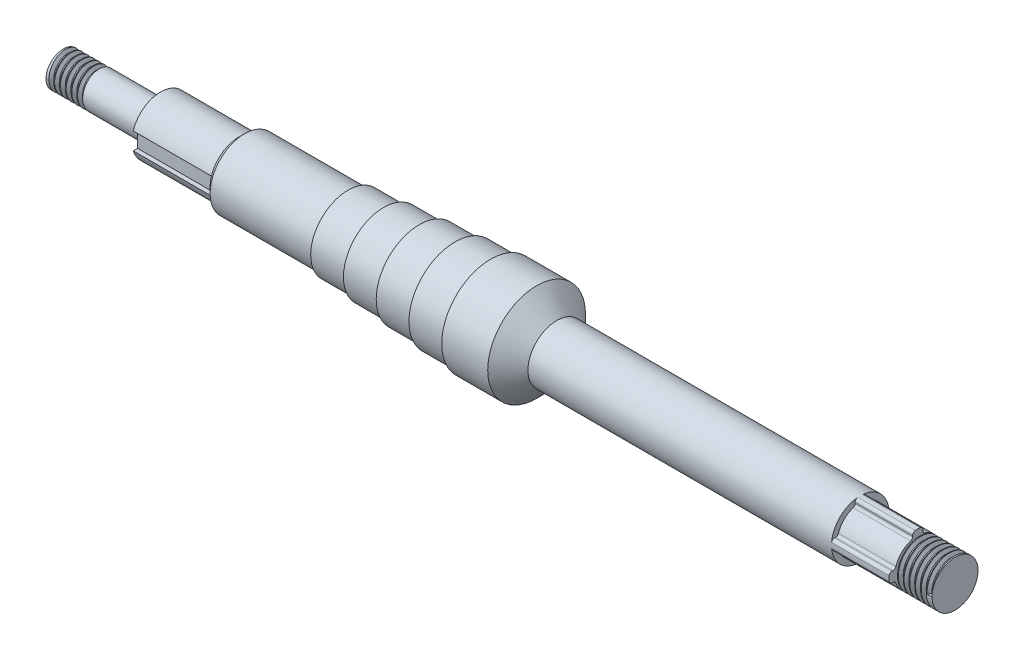
from build123d import *

# Parameters (mm, degrees)
THREAD1_PITCH      = 1
THREAD1_TO         = 6.5
THREAD2_PITCH      = 1
CUT_EXTRUDE2_START = -10
CUT_EXTRUDE2_DEPTH = 10
FILLET1_START      = 138.66
FILLET1_DEPTH      = 11.34
FILLET1_START_2    = 138
FILLET1_2_DEPTH    = 10.66
CUT_EXTRUDE6_START = -13.61
CUT_EXTRUDE6_DEPTH = 153.351732826
CIRPATTERN1_COUNT  = 2


with BuildPart() as part:
    # Sketch1 → Revolve1 (revolve)
    with BuildSketch(Plane.XY, mode=Mode.PRIVATE) as revolve1_sk:
        Polygon((0, 0), (0, 3), (6.5, 3), (16.94, 3), (16.94, 5), (20.87, 5), (30.55, 5), (31.55, 6), (49.55, 6), (49.55, 6.5), (55.75, 6.5), (55.75, 7), (61.95, 7), (61.95, 7.5), (68.15, 7.5), (68.15, 8), (74.35, 8), (74.35, 8.5), (82.35, 8.5), (85.85, 5), (111.66, 5), (148.66, 5), (148.66, 4), (155.16, 4), (155.16, 0), align=None)
    revolve(revolve1_sk.sketch.rotate(Axis((0, 0, 0), (1, 0, 0)), 90), axis=Axis((0, 0, 0), (1, 0, 0)))

    # Thread1: arcs per turn and ends read off the stored shape
    # Thread1: the profile of Thread Profile1 profile screwed along a right-hand helix through 6.5 turns, 8 arcs to a turn; built about Z, then put on its axis
    thread1_z = Axis((0, 0, 0), (0, 0, 1))
    thread1_corners = [(4.0003, 0, -0.000173205), (4.0003, 0, 0.875173202), (3.458734125, 0, 0.562499999), (3.458734125, 0, 0.312499999)]
    with BuildLine(mode=Mode.PRIVATE) as thread1_profile:
        Line(thread1_corners[0], thread1_corners[1])
        Line(thread1_corners[1], thread1_corners[2])
        Line(thread1_corners[2], thread1_corners[3])
        Line(thread1_corners[3], thread1_corners[0])
    thread1_cap = Face(thread1_profile.wire())
    thread1_turn_angles = [0, 22.5, 45, 67.5, 90, 112.5, 135, 157.5, 180, 202.5, 225, 247.5, 270, 292.5, 315, 337.5, 360]
    thread1_turn_weights = [1, 0.9238795325112867, 1, 0.9238795325112867, 1, 0.9238795325112867, 1, 0.9238795325112867, 1, 0.9238795325112867, 1, 0.9238795325112867, 1, 0.9238795325112867, 1, 0.9238795325112867, 1]
    thread1_turn_rails = [Edge.make_bspline([Vector(p[0], p[1], 0).rotate(thread1_z, thread1_turn_angles[k]) / thread1_turn_weights[k] + Vector(0, 0, p[2] + THREAD1_PITCH * thread1_turn_angles[k] / 360) for k in range(17)], [0, 0, 0, 1, 1, 2, 2, 3, 3, 4, 4, 5, 5, 6, 6, 7, 7, 8, 8, 8], 2, thread1_turn_weights) for p in thread1_corners]
    thread1_turn_sides = [Face.make_surface_from_curves(thread1_turn_rails[p[0]], thread1_turn_rails[p[1]]) for p in [(0, 1), (1, 2), (2, 3), (3, 0)]]
    thread1_last_angles = [2160, 2182.5, 2205, 2227.5, 2250, 2272.5, 2295, 2317.5, 2340]
    thread1_last_weights = [1, 0.9238795325112867, 1, 0.9238795325112867, 1, 0.9238795325112867, 1, 0.9238795325112806, 1]
    thread1_last_rails = [Edge.make_bspline([Vector(p[0], p[1], 0).rotate(thread1_z, thread1_last_angles[k]) / thread1_last_weights[k] + Vector(0, 0, p[2] + THREAD1_PITCH * thread1_last_angles[k] / 360) for k in range(9)], [0, 0, 0, 1, 1, 2, 2, 3, 3, 4, 4, 4], 2, thread1_last_weights) for p in thread1_corners]
    thread1_last_sides = [Face.make_surface_from_curves(thread1_last_rails[p[0]], thread1_last_rails[p[1]]) for p in [(0, 1), (1, 2), (2, 3), (3, 0)]]
    thread1 = Plane(origin=(155.16, 0, 0), x_dir=(0, 0, 1), z_dir=(-1, 0, 0)) * split(Solid(Shell([*[p.moved(Location((0, 0, THREAD1_PITCH * i))) for i in range(6) for p in thread1_turn_sides], *thread1_last_sides, thread1_cap, thread1_cap.rotate(thread1_z, 2340).moved(Location((0, 0, THREAD1_PITCH * 2340 / 360)))])), bisect_by=Plane.XY.offset(THREAD1_TO), keep=Keep.BOTTOM, mode=Mode.PRIVATE)
    add(thread1, mode=Mode.SUBTRACT)

    # Thread2: arcs per turn and ends read off the stored shape
    # Thread2: the profile of Thread Profile2 profile screwed along a right-hand helix through 6 turns, 8 arcs to a turn; built about Z, then put on its axis
    thread2_z = Axis((0, 0, 0), (0, 0, 1))
    thread2_corners = [(3.0003, 0, -0.000173205), (3.0003, 0, 0.875173202), (2.458734125, 0, 0.562499999), (2.458734125, 0, 0.312499999)]
    with BuildLine(mode=Mode.PRIVATE) as thread2_profile:
        Line(thread2_corners[0], thread2_corners[1])
        Line(thread2_corners[1], thread2_corners[2])
        Line(thread2_corners[2], thread2_corners[3])
        Line(thread2_corners[3], thread2_corners[0])
    thread2_cap = Face(thread2_profile.wire())
    thread2_turn_angles = [0, 22.5, 45, 67.5, 90, 112.5, 135, 157.5, 180, 202.5, 225, 247.5, 270, 292.5, 315, 337.5, 360]
    thread2_turn_weights = [1, 0.9238795325112867, 1, 0.9238795325112867, 1, 0.9238795325112867, 1, 0.9238795325112867, 1, 0.9238795325112867, 1, 0.9238795325112867, 1, 0.9238795325112867, 1, 0.9238795325112867, 1]
    thread2_turn_rails = [Edge.make_bspline([Vector(p[0], p[1], 0).rotate(thread2_z, thread2_turn_angles[k]) / thread2_turn_weights[k] + Vector(0, 0, p[2] + THREAD2_PITCH * thread2_turn_angles[k] / 360) for k in range(17)], [0, 0, 0, 1, 1, 2, 2, 3, 3, 4, 4, 5, 5, 6, 6, 7, 7, 8, 8, 8], 2, thread2_turn_weights) for p in thread2_corners]
    thread2_turn_sides = [Face.make_surface_from_curves(thread2_turn_rails[p[0]], thread2_turn_rails[p[1]]) for p in [(0, 1), (1, 2), (2, 3), (3, 0)]]
    thread2 = Plane(origin=(0, 0, 0), x_dir=(0, 0, -1), z_dir=(1, 0, 0)) * Solid(Shell([*[p.moved(Location((0, 0, THREAD2_PITCH * i))) for i in range(6) for p in thread2_turn_sides], thread2_cap, thread2_cap.rotate(thread2_z, 2160).moved(Location((0, 0, THREAD2_PITCH * 2160 / 360)))]))
    add(thread2, mode=Mode.SUBTRACT)

    # Cut-Extrude2: read off the stored shape, not the designer's step
    # Cut-Extrude2 outline → Cut-Extrude2 (cut)
    with BuildSketch(Plane(origin=(148.66, 0, 0), x_dir=(0, 0, -1), z_dir=(1, 0, 0)).offset(CUT_EXTRUDE2_START)):
        with BuildLine():
            ThreePointArc((0.881040396, 3.901764706), (2.828427125, 2.828427125), (3.901764706, 0.881040396))
            Line((3.901764706, 0.881040396), (4.921764706, 0.881040396))
            ThreePointArc((4.921764706, 0.881040396), (3.535533906, 3.535533906), (0.881040396, 4.921764706))
            Line((0.881040396, 4.921764706), (0.881040396, 3.901764706))
        make_face()
        with BuildLine():
            Line((4.921764706, -0.881040396), (3.901764706, -0.881040396))
            ThreePointArc((3.901764706, -0.881040396), (2.828427125, -2.828427125), (0.881040396, -3.901764706))
            Line((0.881040396, -3.901764706), (0.881040396, -4.921764706))
            ThreePointArc((0.881040396, -4.921764706), (3.535533906, -3.535533906), (4.921764706, -0.881040396))
        make_face()
        with BuildLine():
            ThreePointArc((-3.901764706, 0.881040396), (-2.828427125, 2.828427125), (-0.881040396, 3.901764706))
            Line((-0.881040396, 3.901764706), (-0.881040396, 4.921764706))
            ThreePointArc((-0.881040396, 4.921764706), (-3.535533906, 3.535533906), (-4.921764706, 0.881040396))
            Line((-4.921764706, 0.881040396), (-3.901764706, 0.881040396))
        make_face()
        with BuildLine():
            Line((-0.881040396, -4.921764706), (-0.881040396, -3.901764706))
            ThreePointArc((-0.881040396, -3.901764706), (-2.828427125, -2.828427125), (-3.901764706, -0.881040396))
            Line((-3.901764706, -0.881040396), (-4.921764706, -0.881040396))
            ThreePointArc((-4.921764706, -0.881040396), (-3.535533906, -3.535533906), (-0.881040396, -4.921764706))
        make_face()
    extrude(amount=CUT_EXTRUDE2_DEPTH, mode=Mode.SUBTRACT)

    # Fillet1: read off the stored shape, not the designer's step
    # Fillet1 outline → Fillet1 (cut)
    with BuildSketch(Plane.YZ.offset(FILLET1_START)):
        with BuildLine():
            Line((-0.881040396, 4.921764706), (-0.881040396, 4.483838558))
            ThreePointArc((-0.881040396, 4.483838558), (-0.749258342, 4.822092227), (-0.423378218, 4.982042842))
            ThreePointArc((-0.423378218, 4.982042842), (-0.65290531, 4.95718818), (-0.881040396, 4.921764706))
        make_face()
        with BuildLine():
            ThreePointArc((-4.982042842, 0.423378218), (-4.822092227, 0.749258342), (-4.483838558, 0.881040396))
            Line((-4.483838558, 0.881040396), (-4.921764706, 0.881040396))
            ThreePointArc((-4.921764706, 0.881040396), (-4.95718818, 0.65290531), (-4.982042842, 0.423378218))
        make_face()
        with BuildLine():
            ThreePointArc((0.881040396, 4.921764706), (0.65290531, 4.95718818), (0.423378218, 4.982042842))
            ThreePointArc((0.423378218, 4.982042842), (0.749258342, 4.822092227), (0.881040396, 4.483838558))
            Line((0.881040396, 4.483838558), (0.881040396, 4.921764706))
        make_face()
        with BuildLine():
            ThreePointArc((-4.483838558, -0.881040396), (-4.822092227, -0.749258342), (-4.982042842, -0.423378218))
            ThreePointArc((-4.982042842, -0.423378218), (-4.95718818, -0.65290531), (-4.921764706, -0.881040396))
            Line((-4.921764706, -0.881040396), (-4.483838558, -0.881040396))
        make_face()
        with BuildLine():
            ThreePointArc((4.982042842, 0.423378218), (4.95718818, 0.65290531), (4.921764706, 0.881040396))
            Line((4.921764706, 0.881040396), (4.483838558, 0.881040396))
            ThreePointArc((4.483838558, 0.881040396), (4.822092227, 0.749258342), (4.982042842, 0.423378218))
        make_face()
        with BuildLine():
            Line((-0.881040396, -4.483838558), (-0.881040396, -4.921764706))
            ThreePointArc((-0.881040396, -4.921764706), (-0.65290531, -4.95718818), (-0.423378218, -4.982042842))
            ThreePointArc((-0.423378218, -4.982042842), (-0.749258342, -4.822092227), (-0.881040396, -4.483838558))
        make_face()
        with BuildLine():
            ThreePointArc((4.921764706, -0.881040396), (4.95718818, -0.65290531), (4.982042842, -0.423378218))
            ThreePointArc((4.982042842, -0.423378218), (4.822092227, -0.749258342), (4.483838558, -0.881040396))
            Line((4.483838558, -0.881040396), (4.921764706, -0.881040396))
        make_face()
        with BuildLine():
            ThreePointArc((0.881040396, -4.483838558), (0.749258342, -4.822092227), (0.423378218, -4.982042842))
            ThreePointArc((0.423378218, -4.982042842), (0.65290531, -4.95718818), (0.881040396, -4.921764706))
            Line((0.881040396, -4.921764706), (0.881040396, -4.483838558))
        make_face()
    extrude(amount=FILLET1_DEPTH, mode=Mode.SUBTRACT)

    # Fillet1 2 outline → Fillet1 2 (add)
    with BuildSketch(Plane.YZ.offset(FILLET1_START_2)):
        with BuildLine():
            ThreePointArc((-0.881040396, 4.282841046), (-0.976859455, 3.988498105), (-1.227591463, 3.806969819))
            ThreePointArc((-1.227591463, 3.806969819), (-1.055380783, 3.858260152), (-0.881040396, 3.901764706))
            Line((-0.881040396, 3.901764706), (-0.881040396, 4.282841046))
        make_face()
        with BuildLine():
            ThreePointArc((-3.901764706, 0.881040396), (-3.858260152, 1.055380783), (-3.806969819, 1.227591463))
            ThreePointArc((-3.806969819, 1.227591463), (-3.988498105, 0.976859455), (-4.282841046, 0.881040396))
            Line((-4.282841046, 0.881040396), (-3.901764706, 0.881040396))
        make_face()
        with BuildLine():
            Line((0.881040396, 4.282841046), (0.881040396, 3.901764706))
            ThreePointArc((0.881040396, 3.901764706), (1.055380783, 3.858260152), (1.227591463, 3.806969819))
            ThreePointArc((1.227591463, 3.806969819), (0.976859455, 3.988498105), (0.881040396, 4.282841046))
        make_face()
        with BuildLine():
            ThreePointArc((-3.806969819, -1.227591463), (-3.858260152, -1.055380783), (-3.901764706, -0.881040396))
            Line((-3.901764706, -0.881040396), (-4.282841046, -0.881040396))
            ThreePointArc((-4.282841046, -0.881040396), (-3.988498105, -0.976859455), (-3.806969819, -1.227591463))
        make_face()
        with BuildLine():
            ThreePointArc((4.282841046, 0.881040396), (3.988498105, 0.976859455), (3.806969819, 1.227591463))
            ThreePointArc((3.806969819, 1.227591463), (3.858260152, 1.055380783), (3.901764706, 0.881040396))
            Line((3.901764706, 0.881040396), (4.282841046, 0.881040396))
        make_face()
        with BuildLine():
            ThreePointArc((-0.881040396, -3.901764706), (-1.055380783, -3.858260152), (-1.227591463, -3.806969819))
            ThreePointArc((-1.227591463, -3.806969819), (-0.976859455, -3.988498105), (-0.881040396, -4.282841046))
            Line((-0.881040396, -4.282841046), (-0.881040396, -3.901764706))
        make_face()
        with BuildLine():
            Line((4.282841046, -0.881040396), (3.901764706, -0.881040396))
            ThreePointArc((3.901764706, -0.881040396), (3.858260152, -1.055380783), (3.806969819, -1.227591463))
            ThreePointArc((3.806969819, -1.227591463), (3.988498105, -0.976859455), (4.282841046, -0.881040396))
        make_face()
        with BuildLine():
            ThreePointArc((1.227591463, -3.806969819), (1.055380783, -3.858260152), (0.881040396, -3.901764706))
            Line((0.881040396, -3.901764706), (0.881040396, -4.282841046))
            ThreePointArc((0.881040396, -4.282841046), (0.976859455, -3.988498105), (1.227591463, -3.806969819))
        make_face()
    extrude(amount=FILLET1_2_DEPTH)

    # Sketch8 → Cut-Extrude6 (cut)
    with BuildSketch(Plane.ZY.offset(-16.94).offset(CUT_EXTRUDE6_START)):
        Polygon((-48.00129736, 1.5), (-4.769696007, 1.5), (-4, 1.5), (-4, -1.5), (-4.769696007, -1.5), (-48.00129736, -1.5), (-134.464500066, -1.5), (-134.464500066, 1.5), align=None)
    cut_extrude6 = extrude(amount=CUT_EXTRUDE6_DEPTH, mode=Mode.SUBTRACT)

    # CirPattern1: Cut-Extrude6 ×2 about axis
    cirpattern1_axis = Axis((0, 0, 0), (1, 0, 0))
    for i in range(1, CIRPATTERN1_COUNT):
        add(cut_extrude6.rotate(cirpattern1_axis, i * 360 / CIRPATTERN1_COUNT), mode=Mode.SUBTRACT)


solid = part.part
